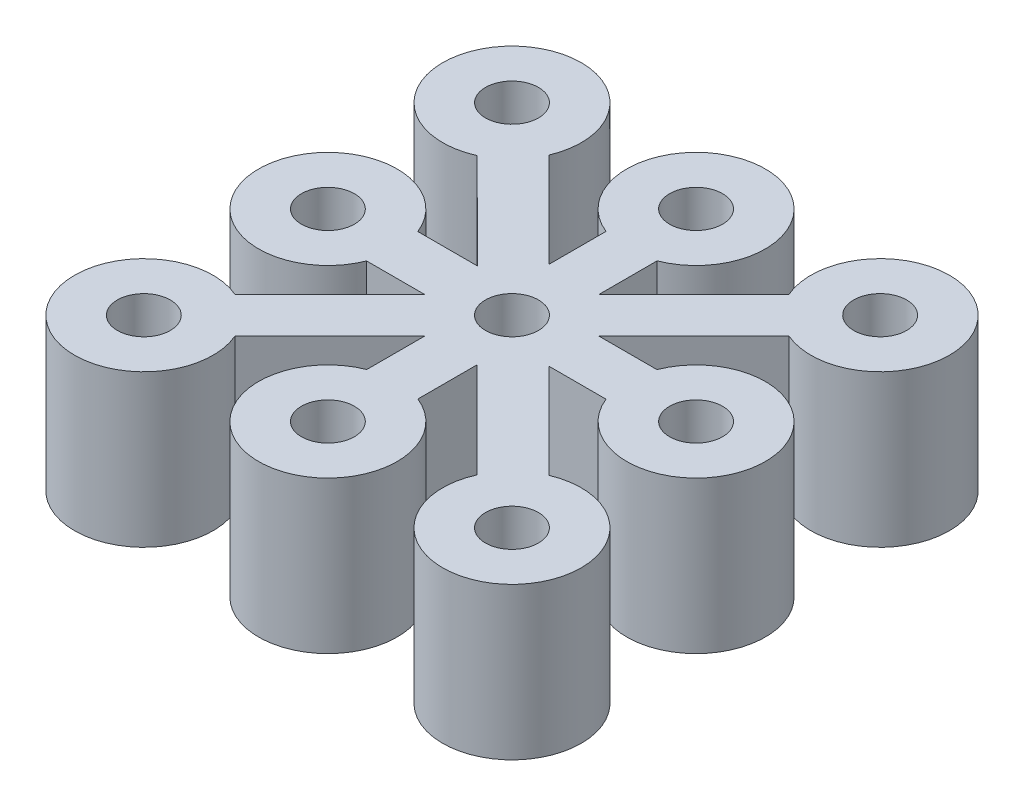
from build123d import *

# Parameters (mm, degrees)
MODEL_R             = 2.61323583
MODEL_R_2           = 2.615311855
BOSS_EXTRUDE1_DEPTH = 15


with BuildPart() as part:
    # Model → Boss-Extrude1 (new body)
    with BuildSketch(Plane(origin=(0, 0, 0), x_dir=(1, 0, 0), z_dir=(0, 1, 0))):
        with BuildLine():
            ThreePointArc((11.811423916, 22.46556455), (25.003638651, 25.016733673), (11.79909852, 27.503320376))
            Line((11.79909852, 27.503320376), (6.045691815, 27.503320376))
            Line((6.045691815, 27.503320376), (15.43469708, 36.890249614))
            ThreePointArc((15.43469708, 36.890249614), (22.999132827, 47.996887916), (11.888984237, 40.437608794))
            Line((11.888984237, 40.437608794), (2.515763874, 31.062300024))
            Line((2.515763874, 31.062300024), (2.515763874, 36.801069103))
            ThreePointArc((2.515763874, 36.801069103), (0.003349394, 50.002407738), (-2.521991952, 36.80353584))
            Line((-2.521991952, 36.80353584), (-2.521991952, 31.155632588))
            Line((-2.521991952, 31.155632588), (-11.861060622, 40.498853243))
            ThreePointArc((-11.861060622, 40.498853243), (-23.050500516, 47.942298142), (-15.353833332, 36.925504082))
            Line((-15.353833332, 36.925504082), (-5.925421547, 27.503320376))
            Line((-5.925421547, 27.503320376), (-11.796917051, 27.503320376))
            ThreePointArc((-11.796917051, 27.503320376), (-24.997668533, 24.98002963), (-11.782403239, 22.533889998))
            Line((-11.782403239, 22.533889998), (-11.782397527, 22.531934092))
            add(Edge.make_bspline(
                [(-11.782397527, 22.531934092), (-11.790701631, 22.509123122), (-11.798993077, 22.488388178), (-11.807284522, 22.46556455)],
                knots=[29, 29, 29, 29, 30, 30, 30, 30], degree=3))
            Line((-11.807284522, 22.46556455), (-6.0809716, 22.46556455))
            Line((-6.0809716, 22.46556455), (-15.436785765, 13.111826412))
            Line((-15.436785765, 13.111826412), (-15.432633713, 13.10767436))
            ThreePointArc((-15.432633713, 13.10767436), (-22.994584744, 2.00333923), (-11.890249614, 9.565290261))
            Line((-11.890249614, 9.565290261), (-2.521991952, 18.937699976))
            Line((-2.521991952, 18.937699976), (-2.521991952, 13.19646416))
            ThreePointArc((-2.521991952, 13.19646416), (0.003349394, -0.002407738), (2.515763874, 13.198930897))
            Line((2.515763874, 13.198930897), (2.515763874, 19.053843509))
            Line((2.515763874, 19.053843509), (11.924385549, 9.643146054))
            ThreePointArc((11.924385549, 9.643146054), (22.941347053, 1.943986341), (15.503142648, 13.138789434))
            Line((15.503142648, 13.138789434), (6.178430899, 22.46556455))
            Line((6.178430899, 22.46556455), (11.811423916, 22.46556455))
        make_face()
        with Locations((-18.15994971, 6.837974264)):
            Circle(MODEL_R, mode=Mode.SUBTRACT)
        with Locations((0, 6.837974264)):
            Circle(MODEL_R, mode=Mode.SUBTRACT)
        with Locations((18.162025736, 6.836942582)):
            Circle(MODEL_R, mode=Mode.SUBTRACT)
        with Locations((-18.15994971, 25)):
            Circle(MODEL_R, mode=Mode.SUBTRACT)
        with Locations((0, 25)):
            Circle(MODEL_R_2, mode=Mode.SUBTRACT)
        with Locations((-18.15994971, 43.162025736)):
            Circle(MODEL_R, mode=Mode.SUBTRACT)
        with Locations((0, 43.162025736)):
            Circle(MODEL_R, mode=Mode.SUBTRACT)
        with Locations((18.164089103, 25)):
            Circle(MODEL_R, mode=Mode.SUBTRACT)
        with Locations((18.162025736, 43.162025736)):
            Circle(MODEL_R, mode=Mode.SUBTRACT)
    boss_extrude1 = extrude(amount=BOSS_EXTRUDE1_DEPTH)

    # Mirror4: Boss-Extrude1 across plane
    add(boss_extrude1.mirror(Plane.ZX.offset(7.5)))

    # Mirror5: Boss-Extrude1 across plane
    add(boss_extrude1.mirror(Plane.ZX.offset(7.5)))


solid = part.part
